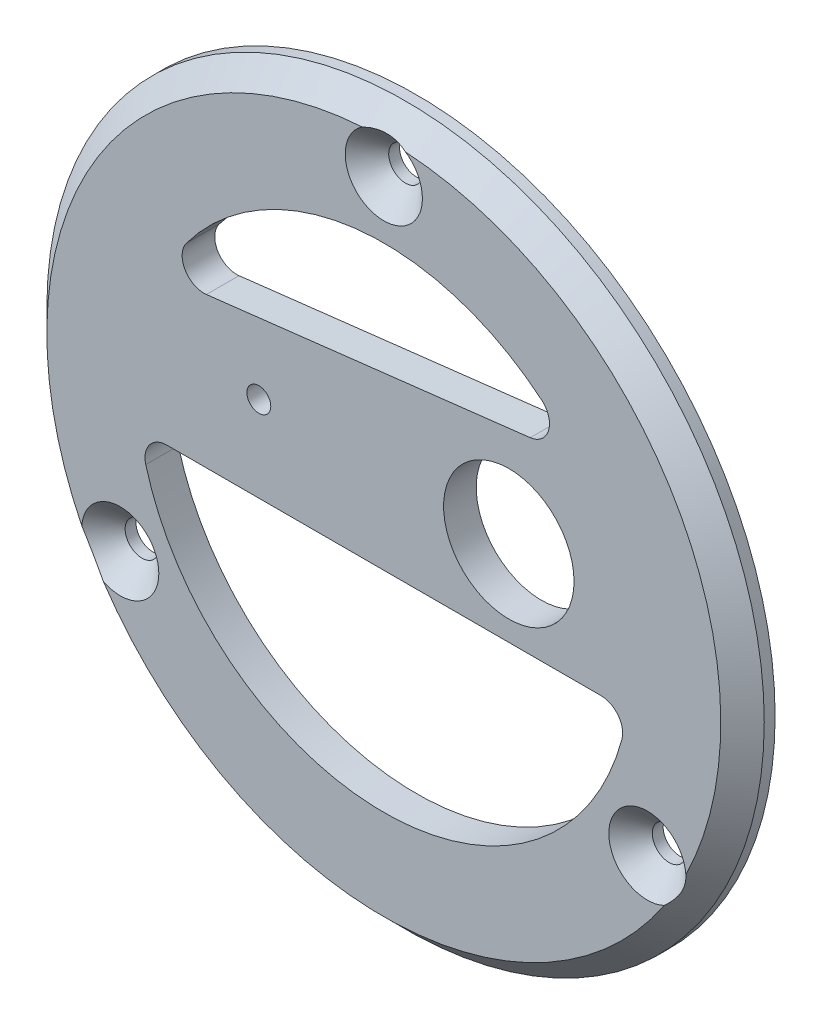
from build123d import *

# Parameters (mm, degrees)
SKETCH1_R                = 15.45
SKETCH1_R_2              = 12.45
SKETCH1_R_3              = 33
SKETCH1_R_4              = 30
SKETCH1_R_5              = 4.05
SKETCH1_R_6              = 1.05
BOSS_EXTRUDE2_DEPTH      = 12.4
BOSS_EXTRUDE3_START      = 3
SKETCH2_R                = 33
BOSS_EXTRUDE3_DEPTH      = 3
SKETCH3_R                = 33
SKETCH3_R_2              = 30
BOSS_EXTRUDE4_DEPTH      = 28.6
FILLET1_R                = 10
BOSS_EXTRUDE5_DEPTH      = 12.4
CHAMFER1_SIZE            = 4
FILLET2_R                = 5
BOSS_EXTRUDE6_DEPTH      = 28.6
BOSS_EXTRUDE6_DEPTH_BACK = 14.4
SKETCH5_R                = 4.55
SKETCH5_R_2              = 1.55
FILLET3_R                = 5
CHAMFER2_SIZE            = 2
SKETCH6_W                = 4
SKETCH6_H                = 2
CUT_EXTRUDE1_DEPTH       = 23.4
SKETCH7_R                = 33
SKETCH7_R_2              = 1.55
SKETCH7_R_3              = 6
BOSS_EXTRUDE7_DEPTH      = 3
CUT_EXTRUDE3_START       = -3
SKETCH8_R                = 60.265040847
CUT_EXTRUDE3_DEPTH       = 127
CHAMFER3_SIZE            = 2
CUT_EXTRUDE4_DEPTH       = 10
FILLET4_R                = 2
SKETCH10_R               = 1.1
CUT_EXTRUDE5_DEPTH       = 10
CHAMFER4_SIZE            = 2


with BuildPart() as part:
    # Sketch1 → Boss-Extrude2 (new body)
    # profile 1 of 4: a face of its own
    with BuildSketch(Plane.XY):
        Circle(SKETCH1_R)
        with Locations(Location((0, 0, 0), (0, 0, 180))):
            Circle(SKETCH1_R_2, mode=Mode.SUBTRACT)
    # profile 2 of 4: a face of its own
    with BuildSketch(Plane.XY):
        with Locations(Location((0, 15.45, 0), (0, 0, 180))):
            Circle(SKETCH1_R_3)
        with Locations((0, 15.45)):
            Circle(SKETCH1_R_4, mode=Mode.SUBTRACT)
    # profile 3 of 4: a face of its own
    with BuildSketch(Plane.XY):
        with Locations(Location((11.5, 19.918584287, 0), (0, 0, 180))):
            Circle(SKETCH1_R_5)
        with Locations(Location((11.5, 19.918584287, 0), (0, 0, 180))):
            Circle(SKETCH1_R_6, mode=Mode.SUBTRACT)
    # profile 4 of 4: a face of its own
    with BuildSketch(Plane.XY):
        with Locations(Location((-11.5, 19.918584287, 0), (0, 0, 180))):
            Circle(SKETCH1_R_5)
        with Locations(Location((-11.5, 19.918584287, 0), (0, 0, 180))):
            Circle(SKETCH1_R_6, mode=Mode.SUBTRACT)
    extrude(amount=BOSS_EXTRUDE2_DEPTH)

    # Sketch2 → Boss-Extrude3 (add)
    with BuildSketch(Plane(origin=(0, 0, 0), x_dir=(-1, 0, 0), z_dir=(0, 0, -1)).offset(BOSS_EXTRUDE3_START)):
        with Locations(Location((0, 15.45, 0), (0, 0, 180))):
            Circle(SKETCH2_R)
    extrude(amount=-BOSS_EXTRUDE3_DEPTH)

    # Sketch3 → Boss-Extrude4 (add)
    with BuildSketch(Plane.XY.offset(12.4)):
        with Locations((0, 15.45)):
            Circle(SKETCH3_R)
        with Locations(Location((0, 15.45, 0), (0, 0, 256.137567884))):
            Circle(SKETCH3_R_2, mode=Mode.SUBTRACT)
    extrude(amount=BOSS_EXTRUDE4_DEPTH)

    # Fillet1
    # the kernel refuses this fillet: 10 mm, written as the material it adds along each edge
    with BuildSketch(Plane(origin=(-7.18774525, -13.676213592, 12.4), x_dir=(-0.20848530714015037, 0.9780254990063793, 0), z_dir=(0, 0, -1))) as fillet1_piece_1:
        with BuildLine():
            CenterArc((31.441766058, -6.395526036), FILLET1_R, 140.241533635, 142.62650255)
            ThreePointArc((33.668828933, -16.144381915), (14.016585538, -13.948724396), (0, 0))
            ThreePointArc((0, 0), (11.877146347, -5.568912274), (23.754292694, 0))
        make_face()
    extrude(amount=12.4)
    with BuildSketch(Plane(origin=(7.18774525, -13.676213592, 12.4), x_dir=(0.20848530714015037, 0.9780254990063793, 0), z_dir=(0, 0, -1))) as fillet1_piece_2:
        with BuildLine():
            CenterArc((31.441766058, 6.395526036), FILLET1_R, 77.131963815, 142.62650255)
            ThreePointArc((33.668828933, 16.144381915), (14.016585538, 13.948724396), (0, 0))
            ThreePointArc((0, 0), (11.877146347, 5.568912274), (23.754292694, 0))
        make_face()
    extrude(amount=12.4)

    # Sketch4 → Boss-Extrude5 (add)
    with BuildSketch(Plane.XY):
        Polygon((-15.355968184, 18.680032971), (-12.140166258, 9.556090373), (-4.457434094, 12.838952207), (4.080215127, 12.838952207), (12.140166258, 9.556090373), (15.355968184, 18.680032971), (9.70403689, 17.830268754), (8.160430255, 22.209822799), (0, 15.45), (-8.160430255, 22.209822799), (-10.090971595, 17.830268754), align=None)
    extrude(amount=BOSS_EXTRUDE5_DEPTH)

    # Chamfer1
    chamfer1_edges = [part.edges().sort_by_distance(p)[0] for p in [
        (0, 45.45, 0),
        (-23.339432443, 6.316081984, 0),
        (23.339432443, 6.316081984, 0),
    ]]
    chamfer(chamfer1_edges, length=CHAMFER1_SIZE)

    # Fillet2
    # the kernel refuses this fillet: 5 mm, written as the material it adds along each edge
    with BuildSketch(Plane(origin=(-11.5, 19.918584287, 0), x_dir=(0.4626548968458433, -0.8865384630260337, 0), z_dir=(0.8865384630260337, 0.4626548968458433, 0))) as fillet2_piece_1:
        with BuildLine():
            CenterArc((4.05 + FILLET2_R, -FILLET2_R), FILLET2_R, 90, 90)
            Line((4.05, -FILLET2_R), (4.05, 0))
            Line((4.05, 0), (4.05 + FILLET2_R, 0))
        make_face()
    revolve(axis=Axis((-11.5, 19.918584287, 0), (0, 0, -1)), revolution_arc=359.64)
    with BuildSketch(Plane(origin=(11.5, 19.918584287, 0), x_dir=(-0.4682160132284685, -0.8836140361925214, 0), z_dir=(0.8836140361925214, -0.4682160132284685, 0))) as fillet2_piece_2:
        with BuildLine():
            CenterArc((4.05 + FILLET2_R, -FILLET2_R), FILLET2_R, 90, 90)
            Line((4.05, -FILLET2_R), (4.05, 0))
            Line((4.05, 0), (4.05 + FILLET2_R, 0))
        make_face()
    revolve(axis=Axis((11.5, 19.918584287, 0), (0, 0, -1)), revolution_arc=359.64)

    # Sketch5 → Boss-Extrude6 (add, two sides: drawn at the far end of the back side and taken through both)
    # profile 1 of 3: a face of its own
    with BuildSketch(Plane.XY.offset(12.4).offset(-BOSS_EXTRUDE6_DEPTH_BACK)):
        with Locations((0, 43.45)):
            Circle(SKETCH5_R)
        with Locations((0, 43.45)):
            Circle(SKETCH5_R_2, mode=Mode.SUBTRACT)
    # profile 2 of 3: a face of its own
    with BuildSketch(Plane.XY.offset(12.4).offset(-BOSS_EXTRUDE6_DEPTH_BACK)):
        with Locations((24.248711306, 1.45)):
            Circle(SKETCH5_R)
        with Locations((24.248711306, 1.45)):
            Circle(SKETCH5_R_2, mode=Mode.SUBTRACT)
    # profile 3 of 3: a face of its own
    with BuildSketch(Plane.XY.offset(12.4).offset(-BOSS_EXTRUDE6_DEPTH_BACK)):
        with Locations((-24.248711306, 1.45)):
            Circle(SKETCH5_R)
        with Locations((-24.248711306, 1.45)):
            Circle(SKETCH5_R_2, mode=Mode.SUBTRACT)
    extrude(amount=BOSS_EXTRUDE6_DEPTH + BOSS_EXTRUDE6_DEPTH_BACK)

    # Fillet3
    fillet3_edges = [part.edges().sort_by_distance(p)[0] for p in [
        (23.612570286, -3.055310711, 26.7),
        (27.832354323, 4.25356964, 26.7),
        (-27.832354323, 4.25356964, 26.7),
        (-23.612570286, -3.055310711, 26.7),
        (4.219784038, 45.151741071, 22.5),
        (-4.219784038, 45.151741071, 22.5),
    ]]
    fillet(fillet3_edges, radius=FILLET3_R)

    # Chamfer2
    chamfer2_edges = [part.edges().sort_by_distance(p)[0] for p in [
        (-33, 15.45, -3),
    ]]
    chamfer(chamfer2_edges, length=CHAMFER2_SIZE)

    # Sketch6 → Cut-Extrude1 (cut)
    with BuildSketch(Plane.XY.offset(12.4)):
        with Locations((0, -13.034949107)):
            Rectangle(SKETCH6_W, SKETCH6_H)
    extrude(amount=-CUT_EXTRUDE1_DEPTH, mode=Mode.SUBTRACT)

    # Sketch7 → Boss-Extrude7 (add)
    with BuildSketch(Plane.XY.offset(41)):
        with Locations((0, 15.45)):
            Circle(SKETCH7_R)
        with Locations((-24.248711306, 1.45)):
            Circle(SKETCH7_R_2, mode=Mode.SUBTRACT)
        with Locations((24.248711306, 1.45)):
            Circle(SKETCH7_R_2, mode=Mode.SUBTRACT)
        with Locations((0, 43.45)):
            Circle(SKETCH7_R_2, mode=Mode.SUBTRACT)
        with Locations((11.5, 19.918584287)):
            Circle(SKETCH7_R_3, mode=Mode.SUBTRACT)
    extrude(amount=BOSS_EXTRUDE7_DEPTH)

    # Sketch8 → Cut-Extrude3 (cut)
    with BuildSketch(Plane.XY.offset(44).offset(CUT_EXTRUDE3_START)):
        with Locations((3.003651401, 17.042715902)):
            Circle(SKETCH8_R)
    extrude(amount=-CUT_EXTRUDE3_DEPTH, mode=Mode.SUBTRACT)

    # Chamfer3
    chamfer3_edges = [part.edges().sort_by_distance(p)[0] for p in [
        (-33, 15.45, 44),
    ]]
    chamfer(chamfer3_edges, length=CHAMFER3_SIZE)

    # Sketch9 → Cut-Extrude4 (cut)
    with BuildSketch(Plane.XY.offset(44)):
        with BuildLine():
            ThreePointArc((17.542861073, 29.835702421), (-2.638036688, 37.983112773), (-20.39130231, 25.394606522))
            Line((-20.39130231, 25.394606522), (17.542861073, 29.835702421))
        make_face()
        with BuildLine():
            Line((22.432842806, 12.063560512), (-22.43109496, 12.052002402))
            ThreePointArc((-22.43109496, 12.052002402), (0.00584476, -7.23700894), (22.432842806, 12.063560512))
        make_face()
    extrude(amount=-CUT_EXTRUDE4_DEPTH, mode=Mode.SUBTRACT)

    # Fillet4
    fillet4_edges = [part.edges().sort_by_distance(p)[0] for p in [
        (17.542861073, 29.835702421, 42.5),
        (-20.39130231, 25.394606522, 42.5),
        (-22.43109496, 12.052002402, 42.5),
        (22.432842806, 12.063560512, 42.5),
    ]]
    fillet(fillet4_edges, radius=FILLET4_R)

    # Sketch10 → Cut-Extrude5 (cut)
    with BuildSketch(Plane.XY.offset(44)):
        with Locations((-11.5, 19.918584287)):
            Circle(SKETCH10_R)
    extrude(amount=-CUT_EXTRUDE5_DEPTH, mode=Mode.SUBTRACT)

    # Chamfer4
    # the kernel refuses this chamfer: 2 mm, written as the material it takes off along each edge
    with BuildSketch(Plane(origin=(0, 43.45, 44), x_dir=(1, 0, 0), z_dir=(0, -1, 0))) as chamfer4_piece_1:
        Polygon((1.55, -CHAMFER4_SIZE), (1.55 + CHAMFER4_SIZE, 0), (1.55, 0), align=None)
    revolve(axis=Axis((0, 43.45, 44), (0, 0, 1)), mode=Mode.SUBTRACT)
    with BuildSketch(Plane(origin=(-24.248711306, 1.45, 44), x_dir=(1, 0, 0), z_dir=(0, -1, 0))) as chamfer4_piece_2:
        Polygon((1.55, -CHAMFER4_SIZE), (1.55 + CHAMFER4_SIZE, 0), (1.55, 0), align=None)
    revolve(axis=Axis((-24.248711306, 1.45, 44), (0, 0, 1)), mode=Mode.SUBTRACT)
    with BuildSketch(Plane(origin=(24.248711306, 1.45, 44), x_dir=(1, 0, 0), z_dir=(0, -1, 0))) as chamfer4_piece_3:
        Polygon((1.55, -CHAMFER4_SIZE), (1.55 + CHAMFER4_SIZE, 0), (1.55, 0), align=None)
    revolve(axis=Axis((24.248711306, 1.45, 44), (0, 0, 1)), mode=Mode.SUBTRACT)


solid = part.part
